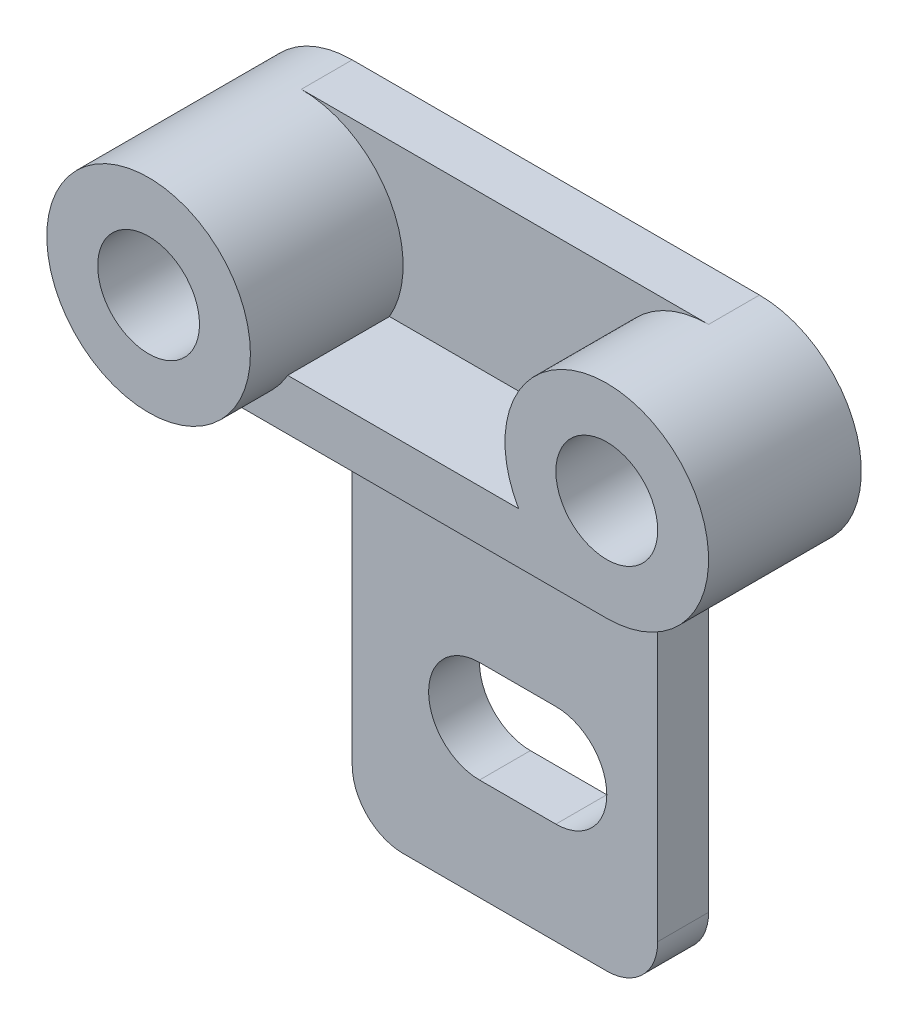
from build123d import *

# Parameters (mm, degrees)
SKETCH1_R           = 10
BOSS_EXTRUDE1_DEPTH = 10
SKETCH1_4_R         = 20
BOSS_EXTRUDE2_DEPTH = 40
SKETCH1_5_R         = 10
CUT_EXTRUDE1_DEPTH  = 133.664991614
BOSS_EXTRUDE3_DEPTH = 30
SKETCH1_11_R        = 10
CUT_EXTRUDE2_DEPTH  = 133.664991614
BOSS_EXTRUDE4_DEPTH = 10


with BuildPart() as part:
    # Sketch1 → Boss-Extrude1 (new body)
    with BuildSketch(Plane.XY):
        with BuildLine():
            Line((100, 40), (20, 40))
            ThreePointArc((20, 40), (0, 20), (20, 0))
            Line((20, 0), (100, 0))
            ThreePointArc((100, 0), (120, 20), (100, 40))
        make_face()
        with Locations((100, 20)):
            Circle(SKETCH1_R, mode=Mode.SUBTRACT)
        with Locations((20, 20)):
            Circle(SKETCH1_R, mode=Mode.SUBTRACT)
    extrude(amount=BOSS_EXTRUDE1_DEPTH)

    # Sketch1<4> → Boss-Extrude2 (add)
    with BuildSketch(Plane.XY):
        with Locations((20, 20)):
            Circle(SKETCH1_4_R)
    extrude(amount=BOSS_EXTRUDE2_DEPTH)

    # Sketch1<5> → Cut-Extrude1 (cut, through all)
    with BuildSketch(Plane.XY):
        with Locations((20, 20)):
            Circle(SKETCH1_5_R)
    extrude(amount=CUT_EXTRUDE1_DEPTH, mode=Mode.SUBTRACT)


with BuildPart() as body_2:
    # Sketch1<10> → Boss-Extrude3 (new body)
    with BuildSketch(Plane.XY):
        with BuildLine():
            ThreePointArc((100, 0), (110, 37.320508076), (82.679491924, 10))
            Line((82.679491924, 10), (37.320508076, 10))
            ThreePointArc((37.320508076, 10), (30, 2.679491924), (20, 0))
            Line((20, 0), (100, 0))
        make_face()
    extrude(amount=BOSS_EXTRUDE3_DEPTH)

    # Sketch1<11> → Cut-Extrude2 (cut, through all)
    with BuildSketch(Plane.XY):
        with Locations((100, 20)):
            Circle(SKETCH1_11_R)
    extrude(amount=CUT_EXTRUDE2_DEPTH, mode=Mode.SUBTRACT)


with BuildPart() as body_3:
    # Sketch1<13> → Boss-Extrude4 (new body)
    with BuildSketch(Plane.XY):
        with BuildLine():
            Line((90, 0), (30, 0))
            Line((30, 0), (30, -70))
            ThreePointArc((30, -70), (32.928932188, -77.071067812), (40, -80))
            Line((40, -80), (80, -80))
            ThreePointArc((80, -80), (87.071067812, -77.071067812), (90, -70))
            Line((90, -70), (90, 0))
        make_face()
        with BuildLine():
            ThreePointArc((55, -60), (45, -50), (55, -40))
            Line((55, -40), (70, -40))
            ThreePointArc((70, -40), (80, -50), (70, -60))
            Line((70, -60), (55, -60))
        make_face(mode=Mode.SUBTRACT)
    extrude(amount=BOSS_EXTRUDE4_DEPTH)


solid = Compound([part.part, body_2.part, body_3.part])
